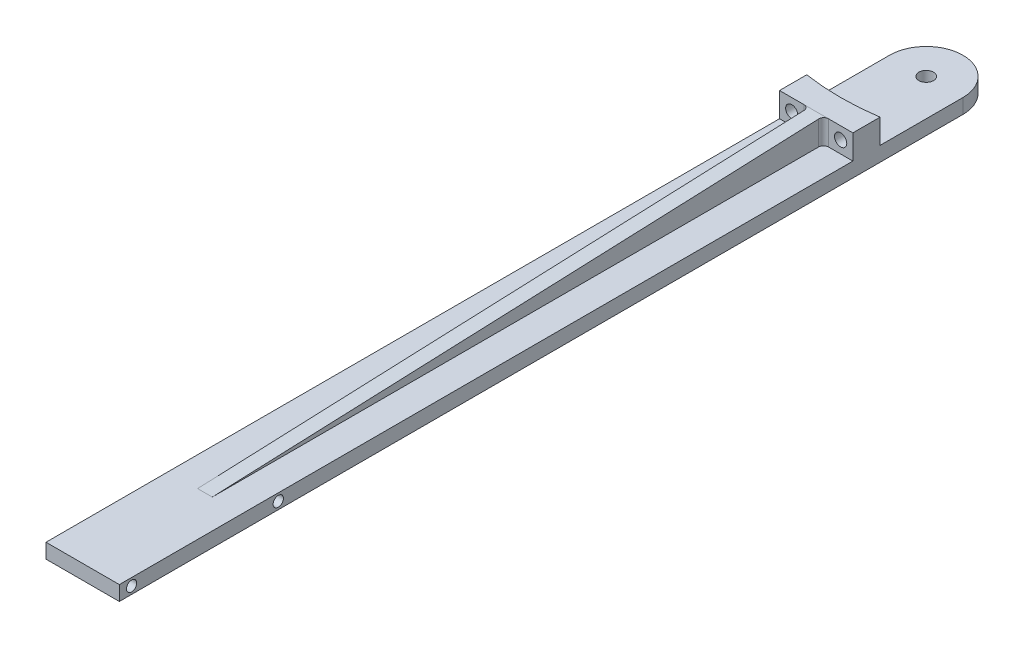
from build123d import *

# Parameters (mm, degrees)
ESQUISSE1_W             = 30
ESQUISSE1_H             = 6
BOSS_EXTRU_1_DEPTH      = 300
BOSS_EXTRU_2_DEPTH      = 3
BOSS_EXTRU_2_DEPTH_BACK = 3
ESQUISSE4_W             = 30
ESQUISSE4_H             = 16
BOSS_EXTRU_3_DEPTH      = 10
ESQUISSE7_R             = 3
BOSS_EXTRU_5_DEPTH      = 6
ESQUISSE8_R             = 2.1
ENL_V_MAT_EXTRU_1_DEPTH = 12
ENL_V_START             = -18
ESQUISSE8_2_R           = 2.1
ENL_V_MAT_EXTRU_3_DEPTH = 12
BOSS_EXTRU_6_DEPTH      = 16
ESQUISSE10_R            = 2.5
ENL_V_MAT_EXTRU_4_DEPTH = 302.920519342
CONG_1_R                = 2


with BuildPart() as part:
    # Esquisse1 → Boss.-Extru.1 (new body)
    with BuildSketch(Plane.XY):
        with Locations((15, 3)):
            Rectangle(ESQUISSE1_W, ESQUISSE1_H)
    extrude(amount=BOSS_EXTRU_1_DEPTH)

    # Esquisse3 → Boss.-Extru.2 (add, two sides: drawn at the far end of the back side and taken through both)
    with BuildSketch(Plane(origin=(15, 0, 0), x_dir=(0, 0, -1), z_dir=(1, 0, 0)).offset(-BOSS_EXTRU_2_DEPTH_BACK)):
        Polygon((-250, 6), (0, 16), (0, 6), align=None)
    extrude(amount=BOSS_EXTRU_2_DEPTH + BOSS_EXTRU_2_DEPTH_BACK)

    # Esquisse4 → Boss.-Extru.3 (add)
    with BuildSketch(Plane(origin=(0, 0, 0), x_dir=(-1, 0, 0), z_dir=(0, 0, -1))):
        with Locations((-15, 8)):
            Rectangle(ESQUISSE4_W, ESQUISSE4_H)
    extrude(amount=BOSS_EXTRU_3_DEPTH)

    # Esquisse7 → Boss.-Extru.5 (add)
    with BuildSketch(Plane.XZ):
        with BuildLine():
            Line((0, -10), (0, -45))
            ThreePointArc((0, -45), (15, -60), (30, -45))
            Line((30, -45), (30, -10))
            Line((30, -10), (0, -10))
        make_face()
        with Locations(Location((15, -45, 0), (0, 0, 270))):
            Circle(ESQUISSE7_R, mode=Mode.SUBTRACT)
    extrude(amount=-BOSS_EXTRU_5_DEPTH)

    # Esquisse8 → Enlèv. mat.-Extru.1 (cut)
    with BuildSketch(Plane.ZY):
        with Locations((295, 3)):
            Circle(ESQUISSE8_R)
        with Locations((235, 3)):
            Circle(ESQUISSE8_R)
    extrude(amount=-ENL_V_MAT_EXTRU_1_DEPTH, mode=Mode.SUBTRACT)

    # Esquisse8<2> → Enlèv. mat.-Extru.3 (cut)
    with BuildSketch(Plane.ZY.offset(ENL_V_START)):
        with Locations((295, 3)):
            Circle(ESQUISSE8_2_R)
        with Locations((235, 3)):
            Circle(ESQUISSE8_2_R)
    extrude(amount=-ENL_V_MAT_EXTRU_3_DEPTH, mode=Mode.SUBTRACT)

    # Esquisse9 → Boss.-Extru.6 (add)
    with BuildSketch(Plane(origin=(0, 16, 0), x_dir=(1, 0, 0), z_dir=(0, 1, 0))):
        with BuildLine():
            Line((0, 11.131400334), (0, 0))
            Line((0, 0), (30, 0))
            Line((30, 0), (30, 11.131400334))
            ThreePointArc((30, 11.131400334), (15, 10), (0, 11.131400334))
        make_face()
    extrude(amount=-BOSS_EXTRU_6_DEPTH)

    # Esquisse10 → Enlèv. mat.-Extru.4 (cut, through all)
    with BuildSketch(Plane.XY):
        with Locations((5, 11)):
            Circle(ESQUISSE10_R)
        with Locations((25, 11)):
            Circle(ESQUISSE10_R)
    extrude(amount=-ENL_V_MAT_EXTRU_4_DEPTH, mode=Mode.SUBTRACT)

    # Congé1
    # the kernel refuses this fillet: 2 mm, written as the material it adds along each edge
    with BuildSketch(Plane(origin=(12, 16, 0), x_dir=(-1, 0, 0), z_dir=(0, -1, 0))) as cong_1_piece_1_section:
        with BuildLine():
            CenterArc((CONG_1_R, -CONG_1_R), CONG_1_R, 90, 90)
            Line((0, -CONG_1_R), (0, 0))
            Line((0, 0), (CONG_1_R, 0))
        make_face()
    cong_1_piece_1 = extrude(amount=15, mode=Mode.PRIVATE)
    cong_1_piece_1 = split(cong_1_piece_1, bisect_by=Plane(origin=(11.546773045, 15.973945238, 0.651369053), z_dir=(0, -0.9992009587217895, -0.03996803834887158)), keep=Keep.TOP, mode=Mode.PRIVATE)
    add(cong_1_piece_1)
    with BuildSketch(Plane(origin=(18, 16, 0), x_dir=(1, 0, 0), z_dir=(0, -1, 0))) as cong_1_piece_2_section:
        with BuildLine():
            CenterArc((CONG_1_R, CONG_1_R), CONG_1_R, 180, 90)
            Line((0, CONG_1_R), (0, 0))
            Line((0, 0), (CONG_1_R, 0))
        make_face()
    cong_1_piece_2 = extrude(amount=15, mode=Mode.PRIVATE)
    cong_1_piece_2 = split(cong_1_piece_2, bisect_by=Plane(origin=(18.453226955, 15.973945238, 0.651369053), z_dir=(0, -0.9992009587217895, -0.03996803834887158)), keep=Keep.TOP, mode=Mode.PRIVATE)
    add(cong_1_piece_2)


solid = part.part
